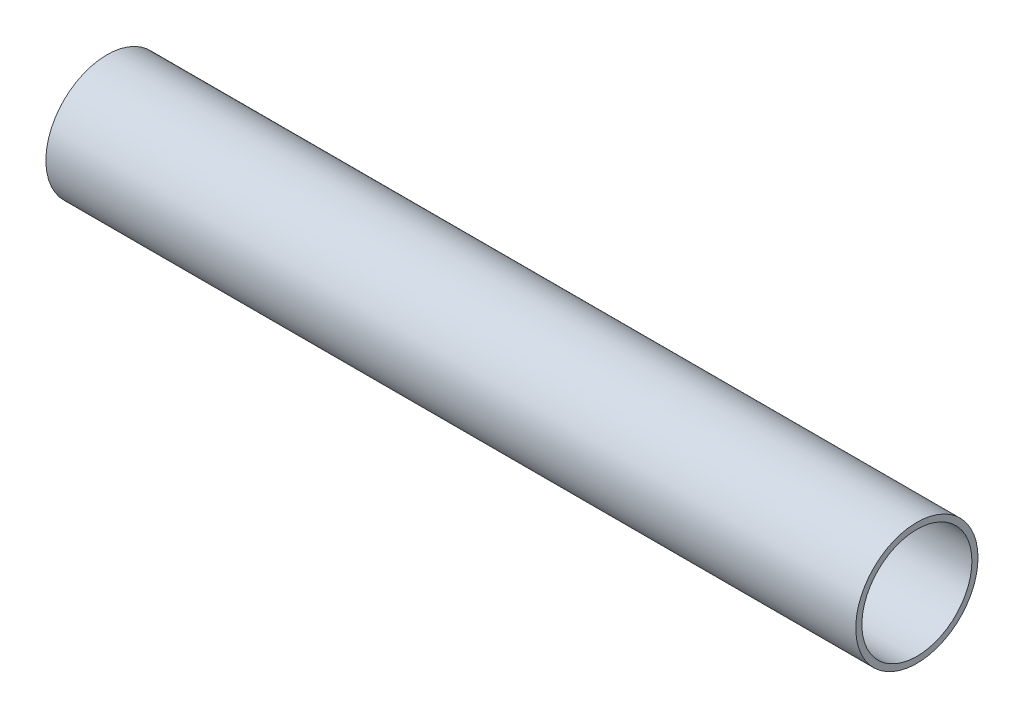
from build123d import *

# Parameters (mm, degrees)
SKETCH1_R           = 15.875
SKETCH1_R_2         = 14.2875
EXTRUDE_THIN1_DEPTH = 105.1745


with BuildPart() as part:
    # Sketch1 → Extrude-Thin1 (new, symmetric)
    with BuildSketch(Plane(origin=(0, 0, 0), x_dir=(0, 0, -1), z_dir=(1, 0, 0))):
        Circle(SKETCH1_R)
        Circle(SKETCH1_R_2, mode=Mode.SUBTRACT)
    extrude(amount=EXTRUDE_THIN1_DEPTH, both=True)


solid = part.part
